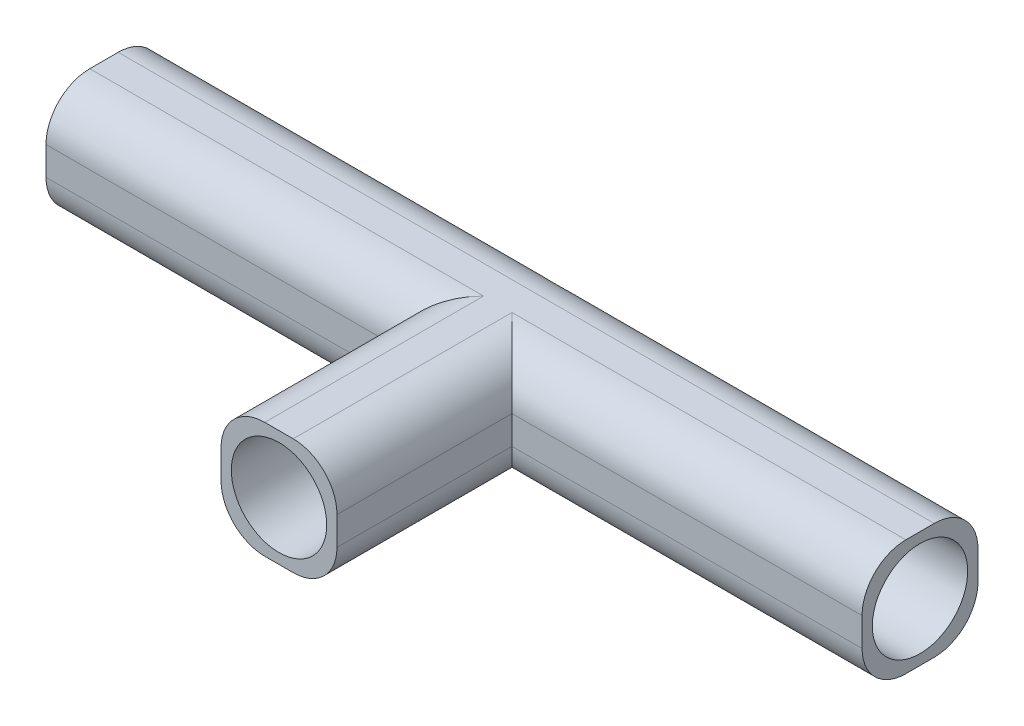
from build123d import *

# Parameters (mm, degrees)
BOSS_EXTRUDE1_DEPTH = 26.5
SKETCH3_R           = 10.9
CUT_EXTRUDE1_DEPTH  = 129.322835068
SKETCH6_W           = 26.5
SKETCH6_H           = 26.5
BOSS_EXTRUDE3_DEPTH = 80
SKETCH7_R           = 10.9
CUT_EXTRUDE2_DEPTH  = 200.766738973
FILLET1_R           = 10


with BuildPart() as part:
    # Sketch2 → Boss-Extrude1 (new body)
    with BuildSketch(Plane(origin=(0, 0, 0), x_dir=(1, 0, 0), z_dir=(0, 1, 0))):
        Polygon((0, 0), (0, 66.5), (106.5, 66.5), (106.5, 40), (26.5, 40), (26.5, 0), align=None)
    extrude(amount=BOSS_EXTRUDE1_DEPTH)

    # Sketch3 → Cut-Extrude1 (cut, through all)
    with BuildSketch(Plane.XY):
        with Locations((13.25, 13.25)):
            Circle(SKETCH3_R)
    extrude(amount=-CUT_EXTRUDE1_DEPTH, mode=Mode.SUBTRACT)

    # Sketch6 → Boss-Extrude3 (add)
    with BuildSketch(Plane.ZY):
        with Locations((-53.25, 13.25)):
            Rectangle(SKETCH6_W, SKETCH6_H)
    extrude(amount=BOSS_EXTRUDE3_DEPTH)

    # Sketch7 → Cut-Extrude2 (cut, through all)
    with BuildSketch(Plane.ZY.offset(80)):
        with Locations((-53.25, 13.25)):
            Circle(SKETCH7_R)
    extrude(amount=-CUT_EXTRUDE2_DEPTH, mode=Mode.SUBTRACT)

    # Fillet1
    # the kernel refuses this fillet: 10 mm, written as the material it takes off along each edge
    with BuildSketch(Plane(origin=(106.5, 26.5, -40), x_dir=(0, 0, -1), z_dir=(-1, 0, 0))) as fillet1_piece_1:
        with BuildLine():
            CenterArc((FILLET1_R, FILLET1_R), FILLET1_R, 180, 90)
            Line((0, FILLET1_R), (-FILLET1_R * 0.02, FILLET1_R))
            Line((-FILLET1_R * 0.02, FILLET1_R), (-FILLET1_R * 0.02, -FILLET1_R * 0.02))
            Line((-FILLET1_R * 0.02, -FILLET1_R * 0.02), (FILLET1_R, -FILLET1_R * 0.02))
            Line((FILLET1_R, -FILLET1_R * 0.02), (FILLET1_R, 0))
        make_face()
    extrude(amount=80, mode=Mode.SUBTRACT)
    with BuildSketch(Plane(origin=(106.5, 26.5, -66.5), x_dir=(0, 0, 1), z_dir=(-1, 0, 0)), Plane(origin=(-80, 0, -66.5), x_dir=(0, 0, 1), z_dir=(1, 0, 0))) as fillet1_piece_2:
        with BuildLine():
            CenterArc((FILLET1_R, -FILLET1_R), FILLET1_R, 90, 90)
            Line((0, -FILLET1_R), (-FILLET1_R * 0.02, -FILLET1_R))
            Line((-FILLET1_R * 0.02, -FILLET1_R), (-FILLET1_R * 0.02, FILLET1_R * 0.02))
            Line((-FILLET1_R * 0.02, FILLET1_R * 0.02), (FILLET1_R, FILLET1_R * 0.02))
            Line((FILLET1_R, FILLET1_R * 0.02), (FILLET1_R, 0))
        make_face()
    extrude(amount=186.5, mode=Mode.SUBTRACT)
    with BuildSketch(Plane(origin=(0, 0, 0), x_dir=(0, 1, 0), z_dir=(0, 0, -1)), Plane(origin=(26.5, 26.5, -40), x_dir=(-1, 0, 0), z_dir=(0, 0, 1))) as fillet1_piece_3:
        with BuildLine():
            CenterArc((FILLET1_R, FILLET1_R), FILLET1_R, 180, 90)
            Line((0, FILLET1_R), (-FILLET1_R * 0.02, FILLET1_R))
            Line((-FILLET1_R * 0.02, FILLET1_R), (-FILLET1_R * 0.02, -FILLET1_R * 0.02))
            Line((-FILLET1_R * 0.02, -FILLET1_R * 0.02), (FILLET1_R, -FILLET1_R * 0.02))
            Line((FILLET1_R, -FILLET1_R * 0.02), (FILLET1_R, 0))
        make_face()
    extrude(amount=40, mode=Mode.SUBTRACT)
    with BuildSketch(Plane(origin=(0, 26.5, 0), x_dir=(0, -1, 0), z_dir=(0, 0, -1)), Plane(origin=(26.5, 0, -40), x_dir=(-1, 0, 0), z_dir=(0, 0, 1))) as fillet1_piece_4:
        with BuildLine():
            CenterArc((FILLET1_R, -FILLET1_R), FILLET1_R, 90, 90)
            Line((0, -FILLET1_R), (-FILLET1_R * 0.02, -FILLET1_R))
            Line((-FILLET1_R * 0.02, -FILLET1_R), (-FILLET1_R * 0.02, FILLET1_R * 0.02))
            Line((-FILLET1_R * 0.02, FILLET1_R * 0.02), (FILLET1_R, FILLET1_R * 0.02))
            Line((FILLET1_R, FILLET1_R * 0.02), (FILLET1_R, 0))
        make_face()
    extrude(amount=40, mode=Mode.SUBTRACT)
    with BuildSketch(Plane(origin=(0, 0, -40), x_dir=(0, 0, -1), z_dir=(-1, 0, 0)), Plane(origin=(0, 26.5, -40), x_dir=(0, -1, 0), z_dir=(-1, 0, 0)), Plane(origin=(106.5, 0, -40), x_dir=(0, 0, -1), z_dir=(-1, 0, 0))) as fillet1_piece_5:
        with BuildLine():
            CenterArc((FILLET1_R, -FILLET1_R), FILLET1_R, 90, 90)
            Line((0, -FILLET1_R), (-FILLET1_R * 0.02, -FILLET1_R))
            Line((-FILLET1_R * 0.02, -FILLET1_R), (-FILLET1_R * 0.02, FILLET1_R * 0.02))
            Line((-FILLET1_R * 0.02, FILLET1_R * 0.02), (FILLET1_R, FILLET1_R * 0.02))
            Line((FILLET1_R, FILLET1_R * 0.02), (FILLET1_R, 0))
        make_face()
    extrude(amount=80, mode=Mode.SUBTRACT)
    with BuildSketch(Plane(origin=(106.5, 26.5, -40), x_dir=(0, 0, -1), z_dir=(-1, 0, 0))) as fillet1_piece_6a_section:
        with BuildLine():
            CenterArc((FILLET1_R, FILLET1_R), FILLET1_R, 180, 90)
            Line((0, FILLET1_R), (-FILLET1_R * 0.02, FILLET1_R))
            Line((-FILLET1_R * 0.02, FILLET1_R), (-FILLET1_R * 0.02, -FILLET1_R * 0.02))
            Line((-FILLET1_R * 0.02, -FILLET1_R * 0.02), (FILLET1_R, -FILLET1_R * 0.02))
            Line((FILLET1_R, -FILLET1_R * 0.02), (FILLET1_R, 0))
        make_face()
    fillet1_piece_6a = extrude(amount=105, mode=Mode.PRIVATE)
    fillet1_piece_6a = split(fillet1_piece_6a, bisect_by=Plane(origin=(26.5, 24.236048857, -42.263951143), z_dir=(-1, 0, 0)), keep=Keep.TOP, mode=Mode.PRIVATE)
    with BuildSketch(Plane(origin=(26.5, 26.5, -65), x_dir=(-1, 0, 0), z_dir=(0, 0, 1))) as fillet1_piece_6b_section:
        with BuildLine():
            CenterArc((FILLET1_R, FILLET1_R), FILLET1_R, 180, 90)
            Line((0, FILLET1_R), (-FILLET1_R * 0.02, FILLET1_R))
            Line((-FILLET1_R * 0.02, FILLET1_R), (-FILLET1_R * 0.02, -FILLET1_R * 0.02))
            Line((-FILLET1_R * 0.02, -FILLET1_R * 0.02), (FILLET1_R, -FILLET1_R * 0.02))
            Line((FILLET1_R, -FILLET1_R * 0.02), (FILLET1_R, 0))
        make_face()
    fillet1_piece_6b = extrude(amount=65, mode=Mode.PRIVATE)
    fillet1_piece_6b = split(fillet1_piece_6b, bisect_by=Plane(origin=(24.236048857, 24.236048857, -40), z_dir=(0, 0, -1)), keep=Keep.TOP, mode=Mode.PRIVATE)
    fillet1_piece_6 = fillet1_piece_6a & fillet1_piece_6b
    add(fillet1_piece_6, mode=Mode.SUBTRACT)
    with BuildSketch(Plane(origin=(0, 0, 0), x_dir=(0, 1, 0), z_dir=(0, 0, -1))) as fillet1_piece_7a_section:
        with BuildLine():
            CenterArc((FILLET1_R, FILLET1_R), FILLET1_R, 180, 90)
            Line((0, FILLET1_R), (-FILLET1_R * 0.02, FILLET1_R))
            Line((-FILLET1_R * 0.02, FILLET1_R), (-FILLET1_R * 0.02, -FILLET1_R * 0.02))
            Line((-FILLET1_R * 0.02, -FILLET1_R * 0.02), (FILLET1_R, -FILLET1_R * 0.02))
            Line((FILLET1_R, -FILLET1_R * 0.02), (FILLET1_R, 0))
        make_face()
    fillet1_piece_7a = extrude(amount=65, mode=Mode.PRIVATE)
    fillet1_piece_7a = split(fillet1_piece_7a, bisect_by=Plane(origin=(2.263951143, 2.263951143, -40), z_dir=(0, 0, -1)), keep=Keep.TOP, mode=Mode.PRIVATE)
    with BuildSketch(Plane(origin=(25, 0, -40), x_dir=(0, 0, -1), z_dir=(-1, 0, 0))) as fillet1_piece_7b_section:
        with BuildLine():
            CenterArc((FILLET1_R, -FILLET1_R), FILLET1_R, 90, 90)
            Line((0, -FILLET1_R), (-FILLET1_R * 0.02, -FILLET1_R))
            Line((-FILLET1_R * 0.02, -FILLET1_R), (-FILLET1_R * 0.02, FILLET1_R * 0.02))
            Line((-FILLET1_R * 0.02, FILLET1_R * 0.02), (FILLET1_R, FILLET1_R * 0.02))
            Line((FILLET1_R, FILLET1_R * 0.02), (FILLET1_R, 0))
        make_face()
    fillet1_piece_7b = extrude(amount=105, mode=Mode.PRIVATE)
    fillet1_piece_7b = split(fillet1_piece_7b, bisect_by=Plane(origin=(0, 2.263951143, -42.263951143), z_dir=(1, 0, 0)), keep=Keep.TOP, mode=Mode.PRIVATE)
    fillet1_piece_7 = fillet1_piece_7a & fillet1_piece_7b
    add(fillet1_piece_7, mode=Mode.SUBTRACT)
    with BuildSketch(Plane(origin=(0, 26.5, 0), x_dir=(0, -1, 0), z_dir=(0, 0, -1))) as fillet1_piece_8a_section:
        with BuildLine():
            CenterArc((FILLET1_R, -FILLET1_R), FILLET1_R, 90, 90)
            Line((0, -FILLET1_R), (-FILLET1_R * 0.02, -FILLET1_R))
            Line((-FILLET1_R * 0.02, -FILLET1_R), (-FILLET1_R * 0.02, FILLET1_R * 0.02))
            Line((-FILLET1_R * 0.02, FILLET1_R * 0.02), (FILLET1_R, FILLET1_R * 0.02))
            Line((FILLET1_R, FILLET1_R * 0.02), (FILLET1_R, 0))
        make_face()
    fillet1_piece_8a = extrude(amount=65, mode=Mode.PRIVATE)
    fillet1_piece_8a = split(fillet1_piece_8a, bisect_by=Plane(origin=(2.263951143, 24.236048857, -40), z_dir=(0, 0, -1)), keep=Keep.TOP, mode=Mode.PRIVATE)
    with BuildSketch(Plane(origin=(25, 26.5, -40), x_dir=(0, -1, 0), z_dir=(-1, 0, 0))) as fillet1_piece_8b_section:
        with BuildLine():
            CenterArc((FILLET1_R, -FILLET1_R), FILLET1_R, 90, 90)
            Line((0, -FILLET1_R), (-FILLET1_R * 0.02, -FILLET1_R))
            Line((-FILLET1_R * 0.02, -FILLET1_R), (-FILLET1_R * 0.02, FILLET1_R * 0.02))
            Line((-FILLET1_R * 0.02, FILLET1_R * 0.02), (FILLET1_R, FILLET1_R * 0.02))
            Line((FILLET1_R, FILLET1_R * 0.02), (FILLET1_R, 0))
        make_face()
    fillet1_piece_8b = extrude(amount=105, mode=Mode.PRIVATE)
    fillet1_piece_8b = split(fillet1_piece_8b, bisect_by=Plane(origin=(0, 24.236048857, -42.263951143), z_dir=(1, 0, 0)), keep=Keep.TOP, mode=Mode.PRIVATE)
    fillet1_piece_8 = fillet1_piece_8a & fillet1_piece_8b
    add(fillet1_piece_8, mode=Mode.SUBTRACT)
    with BuildSketch(Plane(origin=(106.5, 0, -40), x_dir=(0, 0, -1), z_dir=(-1, 0, 0))) as fillet1_piece_9a_section:
        with BuildLine():
            CenterArc((FILLET1_R, -FILLET1_R), FILLET1_R, 90, 90)
            Line((0, -FILLET1_R), (-FILLET1_R * 0.02, -FILLET1_R))
            Line((-FILLET1_R * 0.02, -FILLET1_R), (-FILLET1_R * 0.02, FILLET1_R * 0.02))
            Line((-FILLET1_R * 0.02, FILLET1_R * 0.02), (FILLET1_R, FILLET1_R * 0.02))
            Line((FILLET1_R, FILLET1_R * 0.02), (FILLET1_R, 0))
        make_face()
    fillet1_piece_9a = extrude(amount=105, mode=Mode.PRIVATE)
    fillet1_piece_9a = split(fillet1_piece_9a, bisect_by=Plane(origin=(26.5, 2.263951143, -42.263951143), z_dir=(-1, 0, 0)), keep=Keep.TOP, mode=Mode.PRIVATE)
    with BuildSketch(Plane(origin=(26.5, 0, -65), x_dir=(-1, 0, 0), z_dir=(0, 0, 1))) as fillet1_piece_9b_section:
        with BuildLine():
            CenterArc((FILLET1_R, -FILLET1_R), FILLET1_R, 90, 90)
            Line((0, -FILLET1_R), (-FILLET1_R * 0.02, -FILLET1_R))
            Line((-FILLET1_R * 0.02, -FILLET1_R), (-FILLET1_R * 0.02, FILLET1_R * 0.02))
            Line((-FILLET1_R * 0.02, FILLET1_R * 0.02), (FILLET1_R, FILLET1_R * 0.02))
            Line((FILLET1_R, FILLET1_R * 0.02), (FILLET1_R, 0))
        make_face()
    fillet1_piece_9b = extrude(amount=65, mode=Mode.PRIVATE)
    fillet1_piece_9b = split(fillet1_piece_9b, bisect_by=Plane(origin=(24.236048857, 2.263951143, -40), z_dir=(0, 0, -1)), keep=Keep.TOP, mode=Mode.PRIVATE)
    fillet1_piece_9 = fillet1_piece_9a & fillet1_piece_9b
    add(fillet1_piece_9, mode=Mode.SUBTRACT)


solid = part.part
